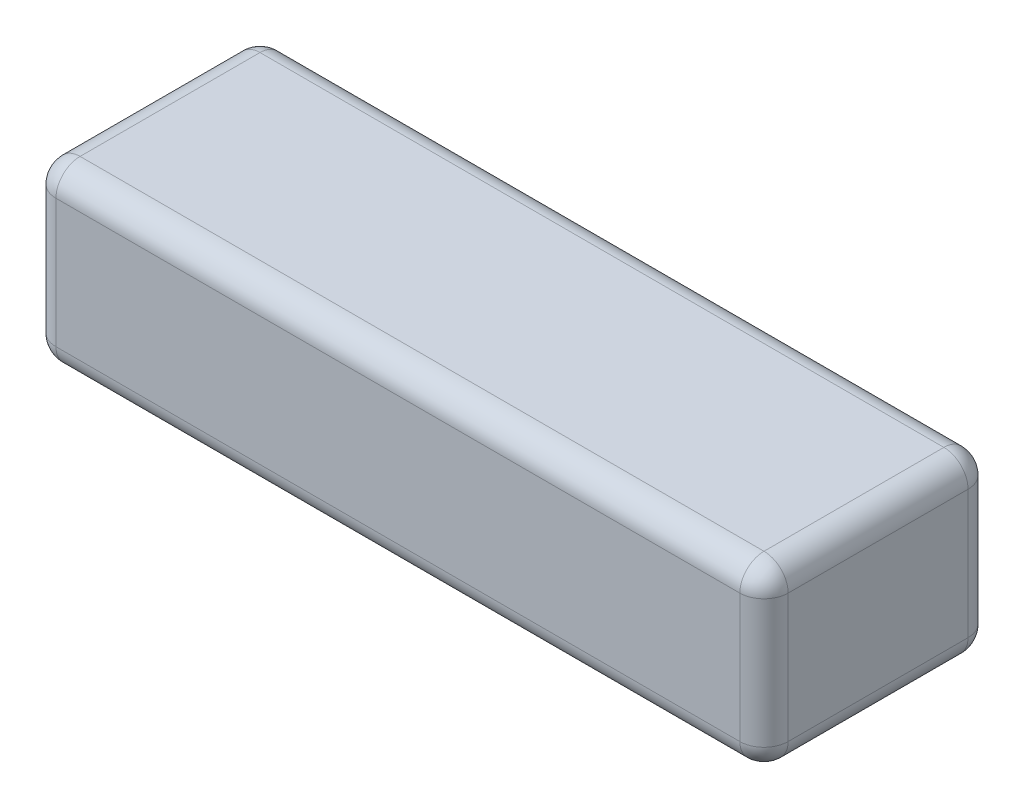
from build123d import *

# Parameters (mm, degrees)
SKETCH1_W           = 154
SKETCH1_H           = 48
BOSS_EXTRUDE1_DEPTH = 37.2
FILLET1_R           = 5.08


with BuildPart() as part:
    # Sketch1 → Boss-Extrude1 (new body)
    with BuildSketch(Plane(origin=(0, 0, 0), x_dir=(1, 0, 0), z_dir=(0, 1, 0))):
        Rectangle(SKETCH1_W, SKETCH1_H)
    extrude(amount=BOSS_EXTRUDE1_DEPTH)

    # Fillet1
    fillet1_edges = [part.edges().sort_by_distance(p)[0] for p in [
        (-77, 18.6, -24),
        (-77, 18.6, 24),
        (77, 18.6, 24),
        (77, 18.6, -24),
        (0, 0, -24),
        (-77, 0, 0),
        (0, 0, 24),
        (77, 0, 0),
        (0, 37.2, 24),
        (-77, 37.2, 0),
        (0, 37.2, -24),
        (77, 37.2, 0),
    ]]
    fillet(fillet1_edges, radius=FILLET1_R)


solid = part.part
